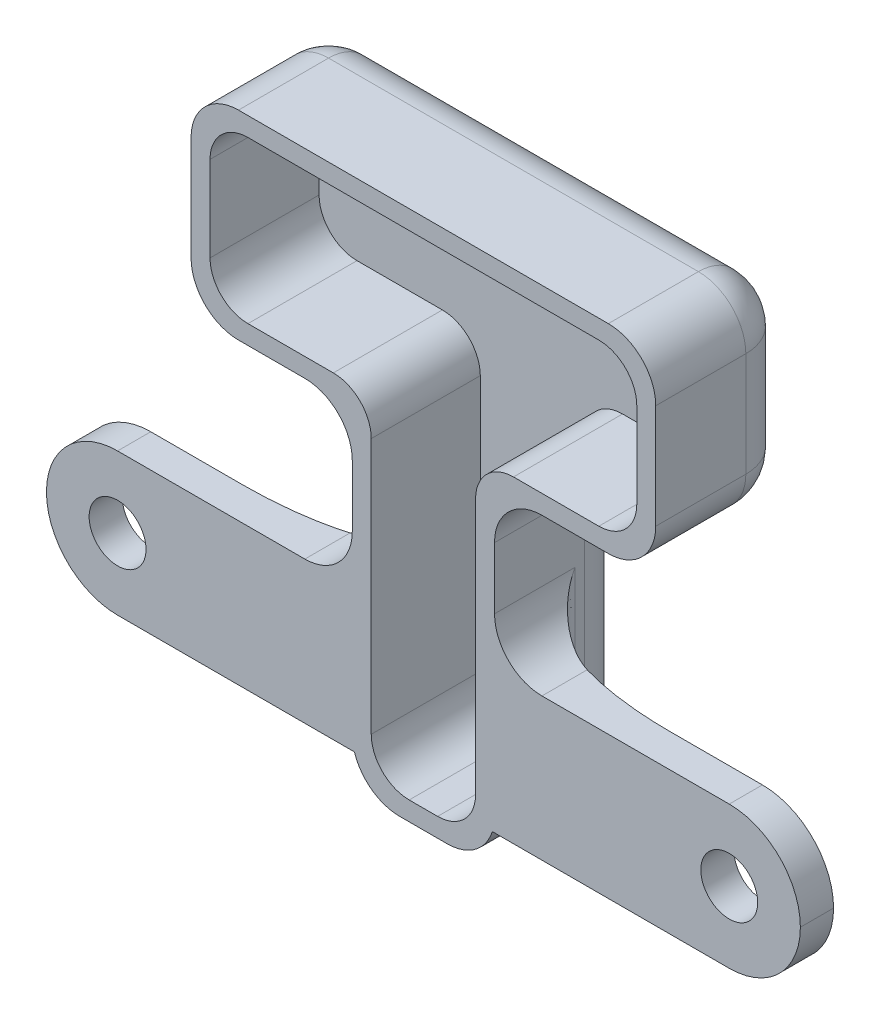
from build123d import *

# Parameters (mm, degrees)
BOSS_EXTRUDE1_DEPTH = 3
BOSS_EXTRUDE5_DEPTH = 11.5
SKETCH7_W           = 32.25
SKETCH7_H           = 15
SKETCH7_R           = 3
BOSS_EXTRUDE6_DEPTH = 3.5
FILLET4_R           = 4
FILLET5_R           = 5
FILLET6_SIZE        = 5
FILLET6_SIZE_2      = 15
FILLET7_START       = 5.9999999
FILLET7_DEPTH       = 8.5000001
FILLET7_START_2     = 18.5
FILLET7_2_DEPTH     = 5.5
FILLET8_R           = 7.5
SKETCH9_R           = 1.05
CUT_EXTRUDE2_DEPTH  = 70.629824804
SKETCH10_R          = 1.75
CUT_EXTRUDE3_DEPTH  = 1.5


with BuildPart() as part:
    # Sketch1 → Boss-Extrude1 (new body)
    with BuildSketch(Plane.XY):
        Polygon((7.5, 35), (24.5, 35), (24.5, 56), (-24.5, 56), (-24.5, 35), (-7.5, 35), (-7.5, 0), (7.5, 0), align=None)
    extrude(amount=BOSS_EXTRUDE1_DEPTH)

    # Sketch6 → Boss-Extrude5 (add)
    with BuildSketch(Plane.XY.offset(3)):
        Polygon((-24.5, 35), (-7.5, 35), (-7.5, 0), (7.5, 0), (7.5, 35), (24.5, 35), (24.5, 56), (-24.5, 56), align=None)
        Polygon((-22.5, 37), (-5.5, 37), (-5.5, 2), (5.5, 2), (5.5, 37), (22.5, 37), (22.5, 54), (-22.5, 54), align=None, mode=Mode.SUBTRACT)
    extrude(amount=BOSS_EXTRUDE5_DEPTH)

    # Sketch7 → Boss-Extrude6 (add)
    # profile 1 of 2: a face of its own
    with BuildSketch(Plane(origin=(0, 0, 14.5), x_dir=(-1, 0, 0), z_dir=(0, 0, -1))):
        with Locations((-23.625, 11)):
            Rectangle(SKETCH7_W, SKETCH7_H)
        with Locations((-32.25, 11)):
            Circle(SKETCH7_R, mode=Mode.SUBTRACT)
    # profile 2 of 2: a face of its own
    with BuildSketch(Plane(origin=(0, 0, 14.5), x_dir=(-1, 0, 0), z_dir=(0, 0, -1))):
        with Locations((23.625, 11)):
            Rectangle(SKETCH7_W, SKETCH7_H)
        with Locations(Location((32.25, 11, 0), (0, 0, 180))):
            Circle(SKETCH7_R, mode=Mode.SUBTRACT)
    extrude(amount=BOSS_EXTRUDE6_DEPTH)

    # Fillet4
    fillet4_edges = [part.edges().sort_by_distance(p)[0] for p in [
        (-22.5, 37, 8.75),
        (-5.5, 37, 8.75),
        (-5.5, 2, 8.75),
        (5.5, 2, 8.75),
        (5.5, 37, 8.75),
        (22.5, 37, 8.75),
        (22.5, 54, 8.75),
        (-22.5, 54, 8.75),
    ]]
    fillet(fillet4_edges, radius=FILLET4_R)

    # Fillet5
    fillet5_edges = [part.edges().sort_by_distance(p)[0] for p in [
        (-7.5, 35, 7.25),
        (7.5, 35, 7.25),
        (-7.5, 0, 7.25),
        (7.5, 0, 7.25),
        (0, 0, 0),
        (7.5, 17.5, 0),
        (-7.5, 17.5, 0),
        (-16, 35, 0),
        (16, 35, 0),
        (-24.5, 45.5, 0),
        (24.5, 45.5, 0),
        (0, 56, 0),
        (24.5, 35, 7.25),
        (24.5, 56, 7.25),
        (-24.5, 35, 7.25),
        (-24.5, 56, 7.25),
    ]]
    fillet(fillet5_edges, radius=FILLET5_R)

    # Fillet6
    # a fillet whose section is not a circle: 15, 5 mm, written as the material it adds along each edge
    with BuildSketch(Plane(origin=(-2.5, 5, 11), x_dir=(-1, 0, 0), z_dir=(0, 1, 0))) as fillet6_piece_1_section:
        with BuildLine():
            Bezier((5, -FILLET6_SIZE), (5, 0), (5 + FILLET6_SIZE_2, 0), weights=[1, 0.707106781, 1])
            Line((5 + FILLET6_SIZE_2, 0), (5, 0))
            Line((5, 0), (5, -FILLET6_SIZE))
        make_face()
    fillet6_piece_1 = revolve(axis=Axis((-2.5, 5, 11), (0, 0, 1)), revolution_arc=359.64, mode=Mode.PRIVATE)
    fillet6_piece_1 = split(fillet6_piece_1, bisect_by=Plane(origin=(-2.5, 18.5, 11), z_dir=(0, -1, 0)), keep=Keep.TOP, mode=Mode.PRIVATE)
    fillet6_piece_1 = split(fillet6_piece_1, bisect_by=Plane(origin=(-2.5, 3.5, 11), z_dir=(0, 1, 0)), keep=Keep.TOP, mode=Mode.PRIVATE)
    fillet6_piece_1 = split(fillet6_piece_1, bisect_by=Plane(origin=(-5.5, 5, 11), z_dir=(-1, 0, 0)), keep=Keep.TOP, mode=Mode.PRIVATE)
    add(fillet6_piece_1)
    with BuildSketch(Plane(origin=(-2.5, 5, 11), x_dir=(-1, 0, 0), z_dir=(0, 1, 0))) as fillet6_piece_2_section:
        with BuildLine():
            Bezier((5, -FILLET6_SIZE), (5, 0), (5 + FILLET6_SIZE_2, 0), weights=[1, 0.707106781, 1])
            Line((5 + FILLET6_SIZE_2, 0), (5, 0))
            Line((5, 0), (5, -FILLET6_SIZE))
        make_face()
    fillet6_piece_2 = revolve(axis=Axis((-2.5, 5, 11), (0, 0, 1)), revolution_arc=359.64, mode=Mode.PRIVATE)
    fillet6_piece_2 = split(fillet6_piece_2, bisect_by=Plane(origin=(-2.5, 18.5, 11), z_dir=(0, -1, 0)), keep=Keep.TOP, mode=Mode.PRIVATE)
    fillet6_piece_2 = split(fillet6_piece_2, bisect_by=Plane(origin=(-2.5, 3.5, 11), z_dir=(0, 1, 0)), keep=Keep.TOP, mode=Mode.PRIVATE)
    fillet6_piece_2 = split(fillet6_piece_2, bisect_by=Plane(origin=(5.5, 5, 11), z_dir=(1, 0, 0)), keep=Keep.TOP, mode=Mode.PRIVATE)
    add(fillet6_piece_2)
    with BuildSketch(Plane(origin=(-7.5, 18.5, 11), x_dir=(0, 0, -1), z_dir=(0, -1, 0)), Plane(origin=(7.5, 5, 11), x_dir=(0, 0, -1), z_dir=(0, 1, 0))) as fillet6_piece_3:
        with BuildLine():
            Bezier((FILLET6_SIZE, 0), (0, 0), (0, -FILLET6_SIZE_2), weights=[1, 0.707106781, 1])
            Line((0, -FILLET6_SIZE_2), (0, 0))
            Line((0, 0), (FILLET6_SIZE, 0))
        make_face()
    extrude(amount=13.5)
    with BuildSketch(Plane(origin=(2.5, 5, 11), x_dir=(0.9999802608561371, 0.006283143965559468, 0), z_dir=(0.006283143965559468, -0.9999802608561371, 0))) as fillet6_piece_4_section:
        with BuildLine():
            Bezier((5, -FILLET6_SIZE), (5, 0), (5 + FILLET6_SIZE_2, 0), weights=[1, 0.707106781, 1])
            Line((5 + FILLET6_SIZE_2, 0), (5, 0))
            Line((5, 0), (5, -FILLET6_SIZE))
        make_face()
    fillet6_piece_4 = revolve(axis=Axis((2.5, 5, 11), (0, 0, 1)), revolution_arc=359.64, mode=Mode.PRIVATE)
    fillet6_piece_4 = split(fillet6_piece_4, bisect_by=Plane(origin=(2.5, 18.5, 11), z_dir=(0, -1, 0)), keep=Keep.TOP, mode=Mode.PRIVATE)
    fillet6_piece_4 = split(fillet6_piece_4, bisect_by=Plane(origin=(2.5, 3.5, 11), z_dir=(0, 1, 0)), keep=Keep.TOP, mode=Mode.PRIVATE)
    fillet6_piece_4 = split(fillet6_piece_4, bisect_by=Plane(origin=(5.5, 5, 11), z_dir=(1, 0, 0)), keep=Keep.TOP, mode=Mode.PRIVATE)
    add(fillet6_piece_4)
    with BuildSketch(Plane(origin=(2.5, 5, 11), x_dir=(0.9999802608561371, 0.006283143965559468, 0), z_dir=(0.006283143965559468, -0.9999802608561371, 0))) as fillet6_piece_5_section:
        with BuildLine():
            Bezier((5, -FILLET6_SIZE), (5, 0), (5 + FILLET6_SIZE_2, 0), weights=[1, 0.707106781, 1])
            Line((5 + FILLET6_SIZE_2, 0), (5, 0))
            Line((5, 0), (5, -FILLET6_SIZE))
        make_face()
    fillet6_piece_5 = revolve(axis=Axis((2.5, 5, 11), (0, 0, 1)), revolution_arc=359.64, mode=Mode.PRIVATE)
    fillet6_piece_5 = split(fillet6_piece_5, bisect_by=Plane(origin=(2.5, 18.5, 11), z_dir=(0, -1, 0)), keep=Keep.TOP, mode=Mode.PRIVATE)
    fillet6_piece_5 = split(fillet6_piece_5, bisect_by=Plane(origin=(2.5, 3.5, 11), z_dir=(0, 1, 0)), keep=Keep.TOP, mode=Mode.PRIVATE)
    fillet6_piece_5 = split(fillet6_piece_5, bisect_by=Plane(origin=(-5.5, 5, 11), z_dir=(-1, 0, 0)), keep=Keep.TOP, mode=Mode.PRIVATE)
    add(fillet6_piece_5)

    # Fillet7: read off the stored shape, not the designer's step
    # Fillet7 outline → Fillet7 (add)
    with BuildSketch(Plane.XY.offset(FILLET7_START)):
        with BuildLine():
            Line((-7.5, 18.5), (-7.5, 23.5))
            ThreePointArc((-7.5, 23.5), (-8.964554264, 19.964377926), (-12.500249379, 18.500000006))
            Line((-12.500249379, 18.500000006), (-7.5, 18.5))
        make_face()
        with BuildLine():
            Line((7.5, 18.5), (12.500245622, 18.500000006))
            ThreePointArc((12.500245622, 18.500000006), (8.964552936, 19.964379255), (7.5, 23.5))
            Line((7.5, 23.5), (7.5, 18.5))
        make_face()
    extrude(amount=FILLET7_DEPTH)

    # Fillet7 2 outline → Fillet7 2 (cut)
    with BuildSketch(Plane(origin=(0, 0, 0), x_dir=(1, 0, 0), z_dir=(0, 1, 0)).offset(FILLET7_START_2)):
        with BuildLine():
            Line((-14, -5.9999999), (-14, -10.119735698))
            add(Edge.make_bspline(
                [(-14, -10.119735698), (-7.5, -8.629618531), (-7.5, -6)],
                knots=[0.389274824, 0.389274824, 0.389274824, 1, 1, 1], degree=2, weights=[0.86073517, 0.821122737, 1]))
            Line((-7.5, -6), (-14, -5.9999999))
        make_face()
        with BuildLine():
            add(Edge.make_bspline(
                [(7.5, -6), (7.5, -8.629618531), (14, -10.119735698)],
                knots=[0, 0, 0, 0.610725176, 0.610725176, 0.610725176], degree=2, weights=[1, 0.821122737, 0.86073517]))
            Line((14, -10.119735698), (14, -5.9999999))
            Line((14, -5.9999999), (7.5, -6))
        make_face()
    extrude(amount=FILLET7_2_DEPTH, mode=Mode.SUBTRACT)

    # Fillet8
    fillet8_edges = [part.edges().sort_by_distance(p)[0] for p in [
        (-39.75, 18.5, 12.75),
        (-39.75, 3.5, 12.75),
        (39.75, 18.5, 12.75),
        (39.75, 3.5, 12.75),
    ]]
    fillet(fillet8_edges, radius=FILLET8_R - 0.0001)  # a hair under: the kernel refuses the full size

    # Sketch9 → Cut-Extrude2 (cut, through all)
    with BuildSketch(Plane.XY.offset(3)):
        with Locations((-18.25, 46)):
            Circle(SKETCH9_R)
        with Locations(Location((18.25, 46, 0), (0, 0, 180))):
            Circle(SKETCH9_R)
    extrude(amount=-CUT_EXTRUDE2_DEPTH, mode=Mode.SUBTRACT)

    # Sketch10 → Cut-Extrude3 (cut)
    with BuildSketch(Plane(origin=(0, 0, 0), x_dir=(-1, 0, 0), z_dir=(0, 0, -1))):
        with Locations((-18.25, 46)):
            Circle(SKETCH10_R)
        with Locations((18.25, 46)):
            Circle(SKETCH10_R)
    extrude(amount=-CUT_EXTRUDE3_DEPTH, mode=Mode.SUBTRACT)


solid = part.part
